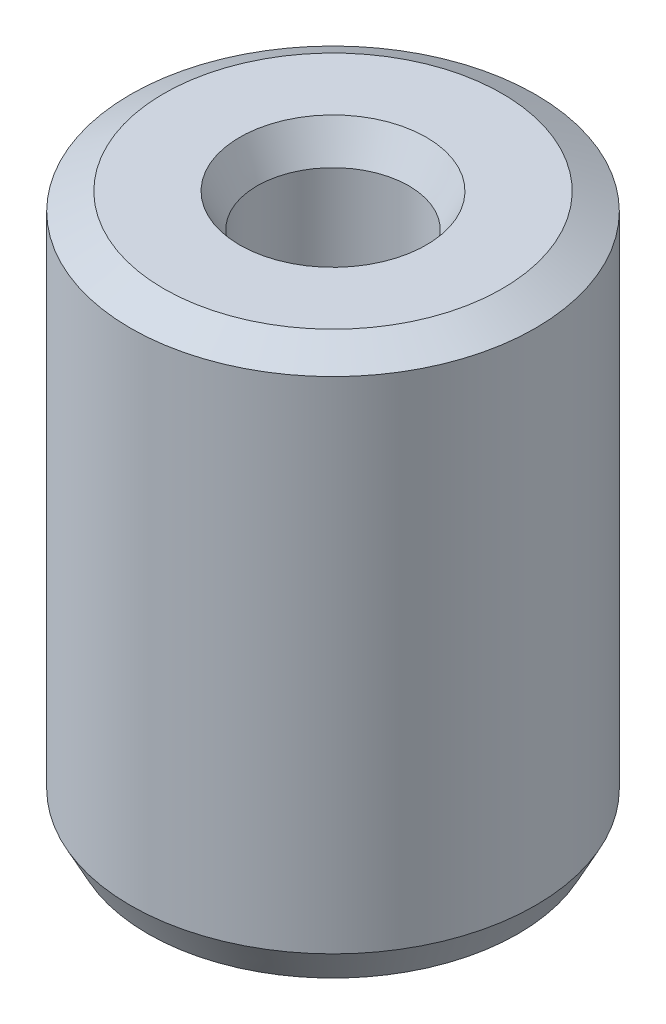
from build123d import *
from OCP.BRepFilletAPI import BRepFilletAPI_MakeChamfer

# Parameters (mm, degrees)
SKETCH1_R           = 22.5
BOSS_EXTRUDE1_DEPTH = 61.204606508
SKETCH2_R           = 8.431263725
CUT_EXTRUDE1_DEPTH  = 69.981909642
CHAMFER1_SIZE       = 1.942209828
CHAMFER1_SIZE2      = 3.70337875


with BuildPart() as part:
    # Sketch1 → Boss-Extrude1 (new body)
    with BuildSketch(Plane(origin=(0, 0, 0), x_dir=(1, 0, 0), z_dir=(0, 1, 0))):
        Circle(SKETCH1_R)
    extrude(amount=BOSS_EXTRUDE1_DEPTH)

    # Sketch2 → Cut-Extrude1 (cut, through all)
    with BuildSketch(Plane(origin=(0, 0, 0), x_dir=(1, 0, 0), z_dir=(0, 1, 0))):
        Circle(SKETCH2_R)
    extrude(amount=CUT_EXTRUDE1_DEPTH, mode=Mode.SUBTRACT)

    # Chamfer1: one chamfer whose edges measure the first distance from different faces: ONE call of the kernel's chamfer builder (chamfer() names one face for all edges)
    chamfer1_edges_1 = [part.edges().sort_by_distance(p)[0] for p in [
        (-8.431263725, 61.204606508, 0),
    ]]
    chamfer1_side_1 = [part.faces().sort_by_distance(p)[0] for p in [
        (-21.863603897, 61.204606508, 0),
    ]]
    chamfer1_edges_2 = [part.edges().sort_by_distance(p)[0] for p in [
        (-8.431263725, 0, 0),
    ]]
    chamfer1_side_2 = [part.faces().sort_by_distance(p)[0] for p in [
        (-8.431263725, 30.602303254, 0),
    ]]
    chamfer1_edges_3 = [part.edges().sort_by_distance(p)[0] for p in [
        (-22.5, 0, 0),
    ]]
    chamfer1_side_3 = [part.faces().sort_by_distance(p)[0] for p in [
        (-21.863603897, 0, 0),
    ]]
    chamfer1_edges_4 = [part.edges().sort_by_distance(p)[0] for p in [
        (-22.5, 61.204606508, 0),
    ]]
    chamfer1_side_4 = [part.faces().sort_by_distance(p)[0] for p in [
        (-22.5, 30.602303254, 0),
    ]]
    chamfer1 = BRepFilletAPI_MakeChamfer(part.part.solid().wrapped)
    for e in chamfer1_edges_1:
        chamfer1.Add(CHAMFER1_SIZE, CHAMFER1_SIZE2, e.wrapped, chamfer1_side_1[0].wrapped)  # the first distance lies on this face
    for e in chamfer1_edges_2:
        chamfer1.Add(CHAMFER1_SIZE, CHAMFER1_SIZE2, e.wrapped, chamfer1_side_2[0].wrapped)  # the first distance lies on this face
    for e in chamfer1_edges_3:
        chamfer1.Add(CHAMFER1_SIZE, CHAMFER1_SIZE2, e.wrapped, chamfer1_side_3[0].wrapped)  # the first distance lies on this face
    for e in chamfer1_edges_4:
        chamfer1.Add(CHAMFER1_SIZE, CHAMFER1_SIZE2, e.wrapped, chamfer1_side_4[0].wrapped)  # the first distance lies on this face
    add(Compound.cast(chamfer1.Shape()), mode=Mode.REPLACE)


solid = part.part
